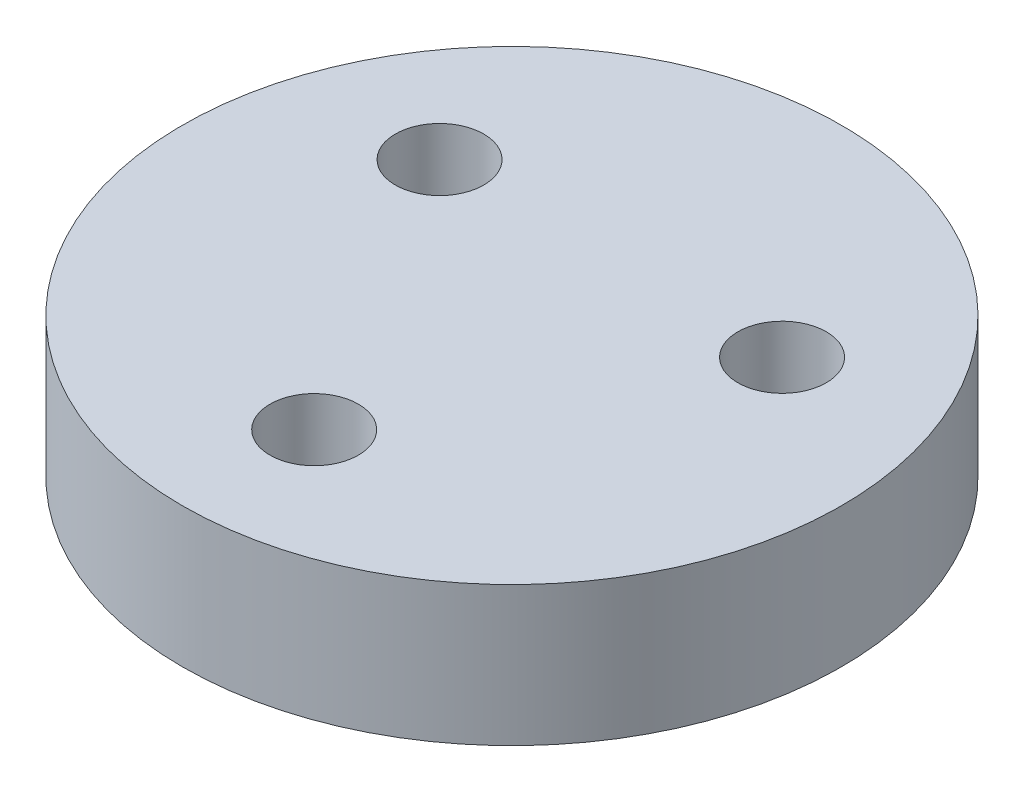
from build123d import *

# Parameters (mm, degrees)
SKETCH4_R           = 30
BOSS_EXTRUDE2_DEPTH = 12.7
SKETCH5_R           = 4.025
CUT_EXTRUDE1_DEPTH  = 12.7


with BuildPart() as part:
    # Sketch4 → Boss-Extrude2 (new body)
    with BuildSketch(Plane(origin=(0, 0, 0), x_dir=(1, 0, 0), z_dir=(0, 1, 0))):
        Circle(SKETCH4_R)
    extrude(amount=BOSS_EXTRUDE2_DEPTH)

    # Sketch5 → Cut-Extrude1 (cut)
    with BuildSketch(Plane.XZ):
        with Locations((0, 18)):
            Circle(SKETCH5_R)
        with Locations((15.588457268, -9)):
            Circle(SKETCH5_R)
        with Locations((-15.588457268, -9)):
            Circle(SKETCH5_R)
    extrude(amount=-CUT_EXTRUDE1_DEPTH, mode=Mode.SUBTRACT)


solid = part.part
